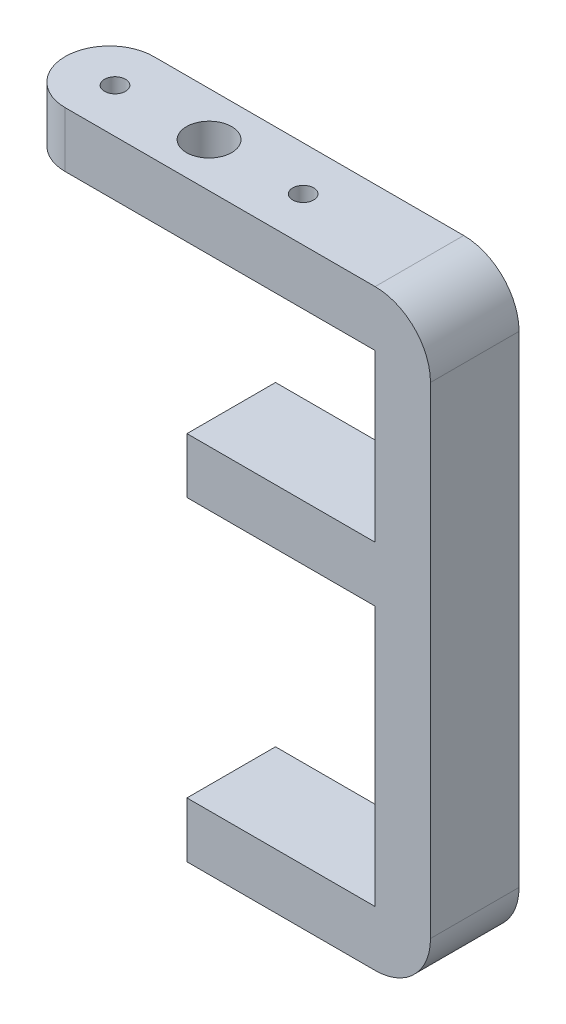
from build123d import *

# Parameters (mm, degrees)
P_IDAT_VYSUNUT_M1_DEPTH  = 4
SKICA2_W                 = 5
SKICA2_H                 = 8
P_IDAT_VYSUNUT_M2_DEPTH  = 20
SKICA3_W                 = 8
SKICA3_H                 = 5
P_IDAT_VYSUNUT_M3_DEPTH  = 32
SKICA5_R                 = 2.04
ODEBRAT_VYSUNUT_M1_DEPTH = 15
ZAOBLIT1_R               = 5
SKICA6_R                 = 1.2
ODEBRAT_VYSUNUT_M2_DEPTH = 8
ZAOBLIT2_R               = 4
SKICA7_R                 = 0.95
ODEBRAT_VYSUNUT_M3_DEPTH = 13
SCALE1_SCALE             = 8


with BuildPart() as part:
    # Skica1 → Přidat vysunutím1 (new, symmetric)
    with BuildSketch(Plane.XY):
        Polygon((0, 0), (17, 0), (17, 23.5), (0, 23.5), (0, 28.5), (22, 28.5), (22, -5), (0, -5), align=None)
    extrude(amount=P_IDAT_VYSUNUT_M1_DEPTH, both=True)

    # Skica2 → Přidat vysunutím2 (add)
    with BuildSketch(Plane(origin=(0, 28.5, 0), x_dir=(1, 0, 0), z_dir=(0, 1, 0))):
        with Locations((19.5, 0)):
            Rectangle(SKICA2_W, SKICA2_H)
    extrude(amount=P_IDAT_VYSUNUT_M2_DEPTH)

    # Skica3 → Přidat vysunutím3 (add)
    with BuildSketch(Plane.ZY.offset(-17)):
        with Locations((0, 46)):
            Rectangle(SKICA3_W, SKICA3_H)
    extrude(amount=P_IDAT_VYSUNUT_M3_DEPTH)

    # Skica5 → Odebrat vysunutím1 (cut)
    with BuildSketch(Plane(origin=(0, 48.5, 0), x_dir=(1, 0, 0), z_dir=(0, 1, 0))):
        with Locations(Location((-2, 0, 0), (0, 0, 270))):
            Circle(SKICA5_R)
    extrude(amount=-ODEBRAT_VYSUNUT_M1_DEPTH, mode=Mode.SUBTRACT)

    # Zaoblit1
    zaoblit1_edges = [part.edges().sort_by_distance(p)[0] for p in [
        (22, -5, 0),
        (22, 48.5, 0),
    ]]
    fillet(zaoblit1_edges, radius=ZAOBLIT1_R)

    # Skica6 → Odebrat vysunutím2 (cut)
    with BuildSketch(Plane.ZY):
        with Locations((-6.1415e-05, 25.09368658)):
            Circle(SKICA6_R)
        with Locations((-5.8558e-05, -1.893787552)):
            Circle(SKICA6_R)
    extrude(amount=-ODEBRAT_VYSUNUT_M2_DEPTH, mode=Mode.SUBTRACT)

    # Zaoblit2
    zaoblit2_edges = [part.edges().sort_by_distance(p)[0] for p in [
        (-15, 46, -4),
        (-15, 46, 4),
    ]]
    fillet(zaoblit2_edges, radius=ZAOBLIT2_R - 0.0001)  # a hair under: the kernel refuses the full size

    # Skica7 → Odebrat vysunutím3 (cut)
    with BuildSketch(Plane(origin=(0, 48.5, 0), x_dir=(1, 0, 0), z_dir=(0, 1, 0))):
        with Locations(Location((-10.5, 0, 0), (0, 0, 270))):
            Circle(SKICA7_R)
        with Locations(Location((6.5, 0, 0), (0, 0, 270))):
            Circle(SKICA7_R)
    extrude(amount=-ODEBRAT_VYSUNUT_M3_DEPTH, mode=Mode.SUBTRACT)


with BuildPart() as part_1:
    # Scale1: scaled about (11.829762973, 25.103410302, 9.66e-07)
    add(part.part.scale(SCALE1_SCALE).moved(Location((-82.808340811, -175.723872114, -6.762e-06))))


solid = part_1.part
